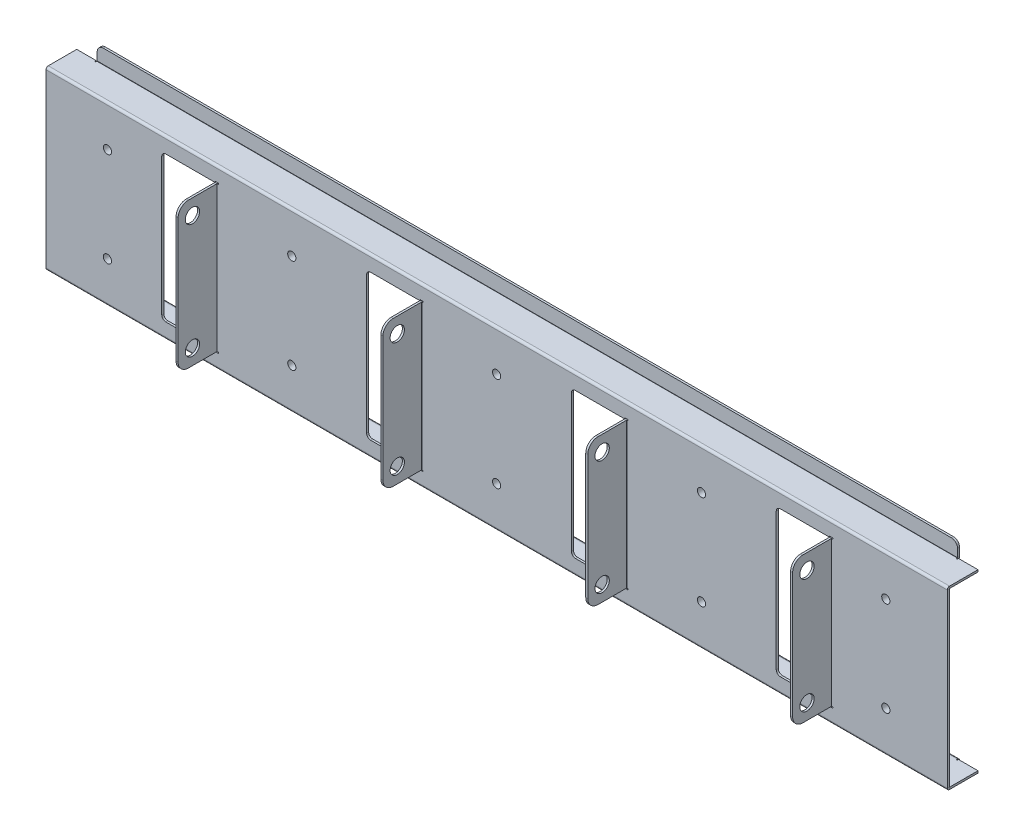
from build123d import *

# Parameters (mm, degrees)
SKETCH_1_W                          = 440
SKETCH_1_H                          = 86
SM_BASE_FLANGE_1_DEPTH              = 1
SM_EDGE_FLANGE_1_STRIP_W            = 4.2
SM_EDGE_FLANGE_1_STRIP_H            = 1
SM_EDGE_FLANGE_1_STRIP_CUT_DEPTH    = 440
SM_EDGE_FLANGE_1_STRIP_2_W          = 4.2
SM_EDGE_FLANGE_1_STRIP_2_H          = 1
SM_EDGE_FLANGE_1_STRIP_CUT_2_DEPTH  = 440
SM_EDGE_FLANGE_1_DEPTH              = 440
SM_EDGE_FLANGE_1_BEND_DEPTH         = 440
SM_EDGE_FLANGE_2_STRIP_W            = 5.2
SM_EDGE_FLANGE_2_STRIP_H            = 1
SM_EDGE_FLANGE_2_STRIP_CUT_DEPTH    = 420
SM_EDGE_FLANGE_2_RELIEF_W           = 5.7
SM_EDGE_FLANGE_2_RELIEF_H           = 0.5
SM_EDGE_FLANGE_2_RELIEF_CUT_DEPTH   = 1
SM_EDGE_FLANGE_2_STRIP_2_W          = 5.2
SM_EDGE_FLANGE_2_STRIP_2_H          = 1
SM_EDGE_FLANGE_2_STRIP_CUT_2_DEPTH  = 420
SM_EDGE_FLANGE_2_RELIEF_2_W         = 5.7
SM_EDGE_FLANGE_2_RELIEF_2_H         = 0.5
SM_EDGE_FLANGE_2_RELIEF_CUT_2_DEPTH = 1
SM_EDGE_FLANGE_2_DEPTH              = 420
SM_EDGE_FLANGE_2_BEND_DEPTH         = 420
SKETCH_18_W                         = 26
SKETCH_18_H                         = 71
CUT_EXTRUDE_1_DEPTH                 = 10
SM_START                            = -36
SM_EDGE_FLANGE_3_DEPTH              = 72
SM_EDGE_FLANGE_3_2_DEPTH            = 0.5
SM_START_2                          = 35.5
SM_EDGE_FLANGE_3_3_DEPTH            = 0.5
SM_START_3                          = -35.5
SM_EDGE_FLANGE_3_4_DEPTH            = 71
SKETCH_22_R                         = 3.5
CUT_EXTRUDE_2_DEPTH                 = 10
FILLET_1_R                          = 5
PATTERN_LINEAR_4_COUNT              = 2
PATTERN_LINEAR_4_PITCH              = 100
FILLET_1_OF_PATTERN_LINEAR_4_R      = 5
PATTERN_LINEAR_5_COUNT              = 3
PATTERN_LINEAR_5_PITCH              = 100
FILLET_1_OF_PATTERN_LINEAR_5_R      = 5
FILLET_2_R                          = 3
FILLET_3_R                          = 2
SKETCH_23_R                         = 2
CUT_EXTRUDE_3_DEPTH                 = 10
SKETCH_24_R                         = 4
SKETCH_24_R_2                       = 2
EXTRUDE_1_DEPTH                     = 3


# Read off the part's stored shape, not the designer's step: 边线-法兰3
# Sheet-metal steps are written as plain solids
with BuildPart() as part:
    # Sketch 1 → 基体-法兰1 (new body)
    with BuildSketch(Plane.XY):
        Rectangle(SKETCH_1_W, SKETCH_1_H)
    extrude(amount=-SM_BASE_FLANGE_1_DEPTH)

    # 边线-法兰1 strip (across the edge) → 边线-法兰1 strip cut (cut)
    with BuildSketch(Plane(origin=(-220, 43, -1), x_dir=(0, -1, 0), z_dir=(1, 0, 0))):
        with Locations((-1, -0.5)):
            Rectangle(SM_EDGE_FLANGE_1_STRIP_W, SM_EDGE_FLANGE_1_STRIP_H)
    extrude(amount=SM_EDGE_FLANGE_1_STRIP_CUT_DEPTH, mode=Mode.SUBTRACT)

    # 边线-法兰1 strip 2 (across the edge) → 边线-法兰1 strip cut 2 (cut)
    with BuildSketch(Plane(origin=(220, -43, -1), x_dir=(0, 1, 0), z_dir=(-1, 0, 0))):
        with Locations((-1, -0.5)):
            Rectangle(SM_EDGE_FLANGE_1_STRIP_2_W, SM_EDGE_FLANGE_1_STRIP_2_H)
    extrude(amount=SM_EDGE_FLANGE_1_STRIP_CUT_2_DEPTH, mode=Mode.SUBTRACT)

    # 边线-法兰1 section (across the edge) → 边线-法兰1 (add)
    with BuildSketch(Plane(origin=(-220, 43, -1), x_dir=(0, -1, 0), z_dir=(1, 0, 0))):
        with BuildLine():
            Line((0, 0.1), (0, 14))
            Line((0, 14), (1, 14))
            Line((1, 14), (1, 0.1))
            ThreePointArc((1, 0.1), (1.029289322, 0.029289322), (1.1, 0))
            Line((1.1, 0), (1.1, -1))
            ThreePointArc((1.1, -1), (0.322182541, -0.677817459), (0, 0.1))
        make_face()
    extrude(amount=SM_EDGE_FLANGE_1_DEPTH)

    # 边线-法兰1 section 2 (across the edge) → 边线-法兰1 bend (add)
    with BuildSketch(Plane(origin=(220, -43, -1), x_dir=(0, 1, 0), z_dir=(-1, 0, 0))):
        with BuildLine():
            Line((0, 0.1), (0, 14))
            Line((0, 14), (1, 14))
            Line((1, 14), (1, 0.1))
            ThreePointArc((1, 0.1), (1.029289322, 0.029289322), (1.1, 0))
            Line((1.1, 0), (1.1, -1))
            ThreePointArc((1.1, -1), (0.322182541, -0.677817459), (0, 0.1))
        make_face()
    extrude(amount=SM_EDGE_FLANGE_1_BEND_DEPTH)

    # 边线-法兰2 strip (across the edge) → 边线-法兰2 strip cut (cut)
    with BuildSketch(Plane(origin=(210, 43, -16), x_dir=(0, 0, 1), z_dir=(-1, 0, 0))):
        with Locations((-1.5, -0.5)):
            Rectangle(SM_EDGE_FLANGE_2_STRIP_W, SM_EDGE_FLANGE_2_STRIP_H)
    extrude(amount=SM_EDGE_FLANGE_2_STRIP_CUT_DEPTH, mode=Mode.SUBTRACT)

    # 边线-法兰2 relief (on the sheet) → 边线-法兰2 relief cut (cut)
    with BuildSketch(Plane(origin=(210, 43, -14.9), x_dir=(0, 0, 1), z_dir=(0, 1, 0))):
        with Locations((-2.35, 0.25)):
            Rectangle(SM_EDGE_FLANGE_2_RELIEF_W, SM_EDGE_FLANGE_2_RELIEF_H)
        with Locations((-2.35, -420.25)):
            Rectangle(SM_EDGE_FLANGE_2_RELIEF_W, SM_EDGE_FLANGE_2_RELIEF_H)
    extrude(amount=-SM_EDGE_FLANGE_2_RELIEF_CUT_DEPTH, mode=Mode.SUBTRACT)

    # 边线-法兰2 strip 2 (across the edge) → 边线-法兰2 strip cut 2 (cut)
    with BuildSketch(Plane(origin=(-210, -43, -16), x_dir=(0, 0, 1), z_dir=(1, 0, 0))):
        with Locations((-1.5, -0.5)):
            Rectangle(SM_EDGE_FLANGE_2_STRIP_2_W, SM_EDGE_FLANGE_2_STRIP_2_H)
    extrude(amount=SM_EDGE_FLANGE_2_STRIP_CUT_2_DEPTH, mode=Mode.SUBTRACT)

    # 边线-法兰2 relief 2 (on the sheet) → 边线-法兰2 relief cut 2 (cut)
    with BuildSketch(Plane(origin=(-210, -43, -14.9), x_dir=(0, 0, 1), z_dir=(0, -1, 0))):
        with Locations((-2.35, 0.25)):
            Rectangle(SM_EDGE_FLANGE_2_RELIEF_2_W, SM_EDGE_FLANGE_2_RELIEF_2_H)
        with Locations((-2.35, -420.25)):
            Rectangle(SM_EDGE_FLANGE_2_RELIEF_2_W, SM_EDGE_FLANGE_2_RELIEF_2_H)
    extrude(amount=-SM_EDGE_FLANGE_2_RELIEF_CUT_2_DEPTH, mode=Mode.SUBTRACT)

    # 边线-法兰2 section (across the edge) → 边线-法兰2 (add)
    with BuildSketch(Plane(origin=(210, 43, -16), x_dir=(0, 0, 1), z_dir=(-1, 0, 0))):
        with BuildLine():
            Line((0, 0.1), (0, 7))
            Line((0, 7), (1, 7))
            Line((1, 7), (1, 0.1))
            ThreePointArc((1, 0.1), (1.029289322, 0.029289322), (1.1, 0))
            Line((1.1, 0), (1.1, -1))
            ThreePointArc((1.1, -1), (0.322182541, -0.677817459), (0, 0.1))
        make_face()
    extrude(amount=SM_EDGE_FLANGE_2_DEPTH)

    # 边线-法兰2 section 2 (across the edge) → 边线-法兰2 bend (add)
    with BuildSketch(Plane(origin=(-210, -43, -16), x_dir=(0, 0, 1), z_dir=(1, 0, 0))):
        with BuildLine():
            Line((0, 0.1), (0, 7))
            Line((0, 7), (1, 7))
            Line((1, 7), (1, 0.1))
            ThreePointArc((1, 0.1), (1.029289322, 0.029289322), (1.1, 0))
            Line((1.1, 0), (1.1, -1))
            ThreePointArc((1.1, -1), (0.322182541, -0.677817459), (0, 0.1))
        make_face()
    extrude(amount=SM_EDGE_FLANGE_2_BEND_DEPTH)

    # 草图18 → 切除-拉伸1 (cut)
    with BuildSketch(Plane.XY):
        with Locations((49.5, 0)):
            Rectangle(SKETCH_18_W, SKETCH_18_H)
    cut_extrude_1 = extrude(amount=-CUT_EXTRUDE_1_DEPTH, mode=Mode.SUBTRACT)

    # 边线-法兰3 outline → 边线-法兰3 (cut)
    with BuildSketch(Plane(origin=(0, 0, 0), x_dir=(1, 0, 0), z_dir=(0, 1, 0)).offset(SM_START)):
        with BuildLine():
            ThreePointArc((62.504554885, 0), (62.858380152, 0.71240384), (63.6, 1))
            Line((63.6, 1), (62.5, 1))
            Line((62.5, 1), (62.5, 0))
            Line((62.5, 0), (62.504554885, 0))
        make_face()
    sm_edge_flange_3 = extrude(amount=SM_EDGE_FLANGE_3_DEPTH, mode=Mode.SUBTRACT)

    # Sm Edge Flange 3 2 outline → Sm Edge Flange 3 2 (cut)
    with BuildSketch(Plane(origin=(0, 0, 0), x_dir=(1, 0, 0), z_dir=(0, 1, 0)).offset(SM_START)):
        with BuildLine():
            Line((64.1, 0), (64.1, 1))
            Line((64.1, 1), (63.6, 1))
            ThreePointArc((63.6, 1), (62.858380152, 0.71240384), (62.504554885, 0))
            Line((62.504554885, 0), (64.1, 0))
        make_face()
    sm_edge_flange_3_2 = extrude(amount=SM_EDGE_FLANGE_3_2_DEPTH, mode=Mode.SUBTRACT)

    # Sm Edge Flange 3 3 outline → Sm Edge Flange 3 3 (cut)
    with BuildSketch(Plane(origin=(0, 0, 0), x_dir=(1, 0, 0), z_dir=(0, 1, 0)).offset(SM_START_2)):
        with BuildLine():
            Line((64.1, 0), (64.1, 1))
            Line((64.1, 1), (63.6, 1))
            ThreePointArc((63.6, 1), (62.858380152, 0.71240384), (62.504554885, 0))
            Line((62.504554885, 0), (64.1, 0))
        make_face()
    sm_edge_flange_3_3 = extrude(amount=SM_EDGE_FLANGE_3_3_DEPTH, mode=Mode.SUBTRACT)

    # Sm Edge Flange 3 4 outline → Sm Edge Flange 3 4 (add)
    with BuildSketch(Plane(origin=(0, 0, 0), x_dir=(1, 0, 0), z_dir=(0, 1, 0)).offset(SM_START_3)):
        with BuildLine():
            ThreePointArc((63.5, -0.1), (63.529289322, -0.029289322), (63.6, 0))
            Line((63.6, 0), (62.504554885, 0))
            ThreePointArc((62.504554885, 0), (62.501139311, -0.049948159), (62.5, -0.1))
            Line((62.5, -0.1), (62.5, -19))
            Line((62.5, -19), (63.5, -19))
            Line((63.5, -19), (63.5, -0.1))
        make_face()
    sm_edge_flange_3_4 = extrude(amount=SM_EDGE_FLANGE_3_4_DEPTH)

    # 草图22 → 切除-拉伸2 (cut)
    with BuildSketch(Plane.ZY.offset(-62.5)):
        with Locations((12, 28)):
            Circle(SKETCH_22_R)
        with Locations((12, -28)):
            Circle(SKETCH_22_R)
    cut_extrude_2 = extrude(amount=-CUT_EXTRUDE_2_DEPTH, mode=Mode.SUBTRACT)

    # 圆角1
    fillet_1_edges = [part.edges().sort_by_distance(p)[0] for p in [
        (63, 35.5, 19),
        (63, -35.5, 19),
    ]]
    fillet(fillet_1_edges, radius=FILLET_1_R)

    # 阵列(线性)4: 切除-拉伸1, 边线-法兰3, Sm Edge Flange 3 2, Sm Edge Flange 3 3, Sm Edge Flange 3 4, 切除-拉伸2 ×2
    with Locations(*[(i * PATTERN_LINEAR_4_PITCH, 0, 0) for i in range(1, PATTERN_LINEAR_4_COUNT)]):
        add(cut_extrude_1, mode=Mode.SUBTRACT)
        add(sm_edge_flange_3, mode=Mode.SUBTRACT)
        add(sm_edge_flange_3_2, mode=Mode.SUBTRACT)
        add(sm_edge_flange_3_3, mode=Mode.SUBTRACT)
        add(sm_edge_flange_3_4)
        add(cut_extrude_2, mode=Mode.SUBTRACT)

    # 圆角1 of 阵列(线性)4
    fillet_1_of_pattern_linear_4_edges = [part.edges().sort_by_distance(p)[0] for p in [
        (163, 35.5, 19),
        (163, -35.5, 19),
    ]]
    fillet(fillet_1_of_pattern_linear_4_edges, radius=FILLET_1_OF_PATTERN_LINEAR_4_R)

    # 阵列(线性)5: 切除-拉伸1, 边线-法兰3, Sm Edge Flange 3 2, Sm Edge Flange 3 3, Sm Edge Flange 3 4, 切除-拉伸2 ×3
    with Locations(*[(-i * PATTERN_LINEAR_5_PITCH, 0, 0) for i in range(1, PATTERN_LINEAR_5_COUNT)]):
        add(cut_extrude_1, mode=Mode.SUBTRACT)
        add(sm_edge_flange_3, mode=Mode.SUBTRACT)
        add(sm_edge_flange_3_2, mode=Mode.SUBTRACT)
        add(sm_edge_flange_3_3, mode=Mode.SUBTRACT)
        add(sm_edge_flange_3_4)
        add(cut_extrude_2, mode=Mode.SUBTRACT)

    # 圆角1 of 阵列(线性)5
    fillet_1_of_pattern_linear_5_edges = [part.edges().sort_by_distance(p)[0] for p in [
        (-37, 35.5, 19),
        (-37, -35.5, 19),
        (-137, 35.5, 19),
        (-137, -35.5, 19),
    ]]
    fillet(fillet_1_of_pattern_linear_5_edges, radius=FILLET_1_OF_PATTERN_LINEAR_5_R)

    # 圆角2
    fillet_2_edges = [part.edges().sort_by_distance(p)[0] for p in [
        (210, 50, -15.5),
        (-210, 50, -15.5),
        (-210, -50, -15.5),
        (210, -50, -15.5),
    ]]
    fillet(fillet_2_edges, radius=FILLET_2_R)

    # 圆角3
    fillet_3_edges = [part.edges().sort_by_distance(p)[0] for p in [
        (36.5, -35.5, -0.5),
        (36.5, 35.5, -0.5),
        (136.5, -35.5, -0.5),
        (136.5, 35.5, -0.5),
        (-63.5, -35.5, -0.5),
        (-63.5, 35.5, -0.5),
        (-163.5, -35.5, -0.5),
        (-163.5, 35.5, -0.5),
    ]]
    fillet(fillet_3_edges, radius=FILLET_3_R)

    # 草图23 → 切除-拉伸3 (cut)
    with BuildSketch(Plane.XY):
        with Locations((100, 23.1)):
            Circle(SKETCH_23_R)
        with Locations((100, -23.1)):
            Circle(SKETCH_23_R)
        with Locations((0, 23.1)):
            Circle(SKETCH_23_R)
        with Locations((0, -23.1)):
            Circle(SKETCH_23_R)
        with Locations((-100, 23.1)):
            Circle(SKETCH_23_R)
        with Locations((-100, -23.1)):
            Circle(SKETCH_23_R)
        with Locations((190, 23.1)):
            Circle(SKETCH_23_R)
        with Locations((190, -23.1)):
            Circle(SKETCH_23_R)
        with Locations((-190, -23.1)):
            Circle(SKETCH_23_R)
        with Locations((-190, 23.1)):
            Circle(SKETCH_23_R)
    extrude(amount=-CUT_EXTRUDE_3_DEPTH, mode=Mode.SUBTRACT)

    # 草图24 → 凸台-拉伸1 (add)
    # profile 1 of 10: a face of its own
    with BuildSketch(Plane(origin=(0, 0, -1), x_dir=(-1, 0, 0), z_dir=(0, 0, -1))):
        with Locations(Location((-100, 23.1, 0), (0, 0, 180))):
            Circle(SKETCH_24_R)
        with Locations(Location((-100, 23.1, 0), (0, 0, 180))):
            Circle(SKETCH_24_R_2, mode=Mode.SUBTRACT)
    # profile 2 of 10: a face of its own
    with BuildSketch(Plane(origin=(0, 0, -1), x_dir=(-1, 0, 0), z_dir=(0, 0, -1))):
        with Locations(Location((-100, -23.1, 0), (0, 0, 180))):
            Circle(SKETCH_24_R)
        with Locations(Location((-100, -23.1, 0), (0, 0, 180))):
            Circle(SKETCH_24_R_2, mode=Mode.SUBTRACT)
    # profile 3 of 10: a face of its own
    with BuildSketch(Plane(origin=(0, 0, -1), x_dir=(-1, 0, 0), z_dir=(0, 0, -1))):
        with Locations(Location((0, 23.1, 0), (0, 0, 180))):
            Circle(SKETCH_24_R)
        with Locations(Location((0, 23.1, 0), (0, 0, 180))):
            Circle(SKETCH_24_R_2, mode=Mode.SUBTRACT)
    # profile 4 of 10: a face of its own
    with BuildSketch(Plane(origin=(0, 0, -1), x_dir=(-1, 0, 0), z_dir=(0, 0, -1))):
        with Locations(Location((0, -23.1, 0), (0, 0, 180))):
            Circle(SKETCH_24_R)
        with Locations(Location((0, -23.1, 0), (0, 0, 180))):
            Circle(SKETCH_24_R_2, mode=Mode.SUBTRACT)
    # profile 5 of 10: a face of its own
    with BuildSketch(Plane(origin=(0, 0, -1), x_dir=(-1, 0, 0), z_dir=(0, 0, -1))):
        with Locations(Location((100, 23.1, 0), (0, 0, 180))):
            Circle(SKETCH_24_R)
        with Locations(Location((100, 23.1, 0), (0, 0, 180))):
            Circle(SKETCH_24_R_2, mode=Mode.SUBTRACT)
    # profile 6 of 10: a face of its own
    with BuildSketch(Plane(origin=(0, 0, -1), x_dir=(-1, 0, 0), z_dir=(0, 0, -1))):
        with Locations(Location((100, -23.1, 0), (0, 0, 180))):
            Circle(SKETCH_24_R)
        with Locations(Location((100, -23.1, 0), (0, 0, 180))):
            Circle(SKETCH_24_R_2, mode=Mode.SUBTRACT)
    # profile 7 of 10: a face of its own
    with BuildSketch(Plane(origin=(0, 0, -1), x_dir=(-1, 0, 0), z_dir=(0, 0, -1))):
        with Locations(Location((-190, 23.1, 0), (0, 0, 180))):
            Circle(SKETCH_24_R)
        with Locations(Location((-190, 23.1, 0), (0, 0, 180))):
            Circle(SKETCH_24_R_2, mode=Mode.SUBTRACT)
    # profile 8 of 10: a face of its own
    with BuildSketch(Plane(origin=(0, 0, -1), x_dir=(-1, 0, 0), z_dir=(0, 0, -1))):
        with Locations(Location((-190, -23.1, 0), (0, 0, 180))):
            Circle(SKETCH_24_R)
        with Locations(Location((-190, -23.1, 0), (0, 0, 180))):
            Circle(SKETCH_24_R_2, mode=Mode.SUBTRACT)
    # profile 9 of 10: a face of its own
    with BuildSketch(Plane(origin=(0, 0, -1), x_dir=(-1, 0, 0), z_dir=(0, 0, -1))):
        with Locations(Location((190, -23.1, 0), (0, 0, 180))):
            Circle(SKETCH_24_R)
        with Locations(Location((190, -23.1, 0), (0, 0, 180))):
            Circle(SKETCH_24_R_2, mode=Mode.SUBTRACT)
    # profile 10 of 10: a face of its own
    with BuildSketch(Plane(origin=(0, 0, -1), x_dir=(-1, 0, 0), z_dir=(0, 0, -1))):
        with Locations(Location((190, 23.1, 0), (0, 0, 180))):
            Circle(SKETCH_24_R)
        with Locations(Location((190, 23.1, 0), (0, 0, 180))):
            Circle(SKETCH_24_R_2, mode=Mode.SUBTRACT)
    extrude(amount=EXTRUDE_1_DEPTH)


solid = part.part
